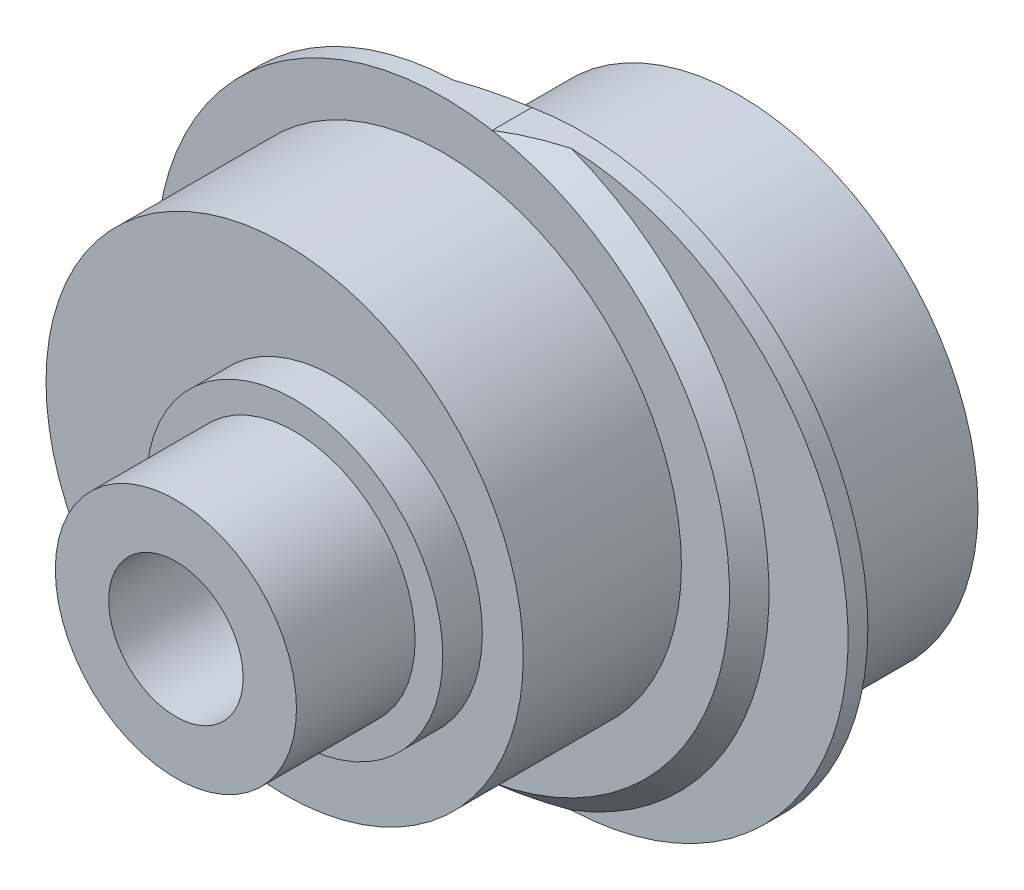
from build123d import *

# Parameters (mm, degrees)
EXTRUDE_START               = -0.5
EXTRUDE_1_OUTLINE_R         = 6.035
EXTRUDE_1_DEPTH             = 4.5
EXTRUDE_START_2             = 4
EXTRUDE_1_2_DEPTH           = 1
SKETCH_2_R                  = 6.035
EXTRUDE_2_DEPTH             = 4
CUT_EXTRUDE_1_DEPTH         = 2
CUT_EXTRUDE_2_DEPTH         = 5.5
HOLE_WIZARD_3_4_3_4_1_D     = 3.4
HOLE_WIZARD_3_4_3_4_1_DEPTH = 13
CHAMFER_1_SIZE              = 0.5


with BuildPart() as part:
    # 凸台-拉伸1: read off the stored shape, not the designer's step
    # 凸台-拉伸1 outline → 凸台-拉伸1 (new body)
    with BuildSketch(Plane.XY.offset(5).offset(EXTRUDE_START)):
        with Locations((-1.25, 0)):
            Circle(EXTRUDE_1_OUTLINE_R)
    extrude(amount=EXTRUDE_1_DEPTH)

    # Extrude 1 2 outline → Extrude 1 2 (add)
    with BuildSketch(Plane.XY.offset(EXTRUDE_START_2)):
        with BuildLine():
            ThreePointArc((0, -7.141428429), (8.5, 0), (0, 7.141428429))
            ThreePointArc((0, 7.141428429), (-8.5, 0), (0, -7.141428429))
        make_face()
    extrude(amount=EXTRUDE_1_2_DEPTH)

    # Extrude 1 3 outline → Extrude 1 3 (revolve, cut)
    with BuildSketch(Plane(origin=(-1.25, 0, 0), x_dir=(1, 0, 0), z_dir=(0, -1, 0))):
        Polygon((7.25, 5), (7.75, 4.5), (9.75, 4.5), (9.75, 5), align=None)
    revolve(axis=Axis((-1.25, 0, 0), (0, 0, 1)), mode=Mode.SUBTRACT)

    # Extrude 1 4 outline → Extrude 1 4 (revolve, cut)
    with BuildSketch(Plane(origin=(1.25, 0, 0), x_dir=(1, 0, 0), z_dir=(0, -1, 0))):
        Polygon((9.75, 4.5), (7.75, 4.5), (7.25, 4), (9.75, 4), align=None)
    revolve(axis=Axis((1.25, 0, 0), (0, 0, 1)), mode=Mode.SUBTRACT)

    # 草图2 → 凸台-拉伸2 (add)
    with BuildSketch(Plane(origin=(0, 0, 4), x_dir=(-1, 0, 0), z_dir=(0, 0, -1))):
        with Locations(Location((-1.25, 0, 0), (0, 0, 180))):
            Circle(SKETCH_2_R)
    extrude(amount=EXTRUDE_2_DEPTH)

    # 草图3 → 切除-拉伸1 (cut)
    with BuildSketch(Plane(origin=(0, 0, 0), x_dir=(-1, 0, 0), z_dir=(0, 0, -1))):
        Polygon((-6, -1.732050808), (-3.16, -1.732050808), (0, -3.556477658), (3.08, -1.778238829), (3.08, 1.778238829), (0, 3.556477658), (-3.16, 1.732050808), (-6, 1.732050808), align=None)
    extrude(amount=-CUT_EXTRUDE_1_DEPTH, mode=Mode.SUBTRACT)

    # 草图4 → 切除-拉伸2 (cut)
    with BuildSketch(Plane(origin=(0, 0, 2), x_dir=(-1, 0, 0), z_dir=(0, 0, -1))):
        Polygon((-3.08, -1.778238829), (0, -3.556477658), (3.08, -1.778238829), (3.08, 1.778238829), (0, 3.556477658), (-3.08, 1.778238829), align=None)
    extrude(amount=-CUT_EXTRUDE_2_DEPTH, mode=Mode.SUBTRACT)

    # 草图5 → 旋转1 (revolve)
    with BuildSketch(Plane.XZ, mode=Mode.PRIVATE) as revolve_1_sk:
        Polygon((3.05, 13), (0, 13), (0, 9), (3.75, 9), (3.75, 10), (3.05, 10), align=None)
    revolve(revolve_1_sk.sketch.rotate(Axis((0, 0, 13), (0, 0, -1)), 180), axis=Axis((0, 0, 13), (0, 0, -1)))

    # Ø3.4 (3.4) 直径孔1
    with Locations(Plane.XY.offset(13)):
        with Locations((0, 0)):
            Hole(HOLE_WIZARD_3_4_3_4_1_D / 2, depth=HOLE_WIZARD_3_4_3_4_1_DEPTH)

    # 倒角1
    chamfer_1_edges = [part.edges().sort_by_distance(p)[0] for p in [
        (4.58, -1.732050808, 0),
        (4.58, 1.732050808, 0),
    ]]
    chamfer(chamfer_1_edges, length=CHAMFER_1_SIZE)


solid = part.part
